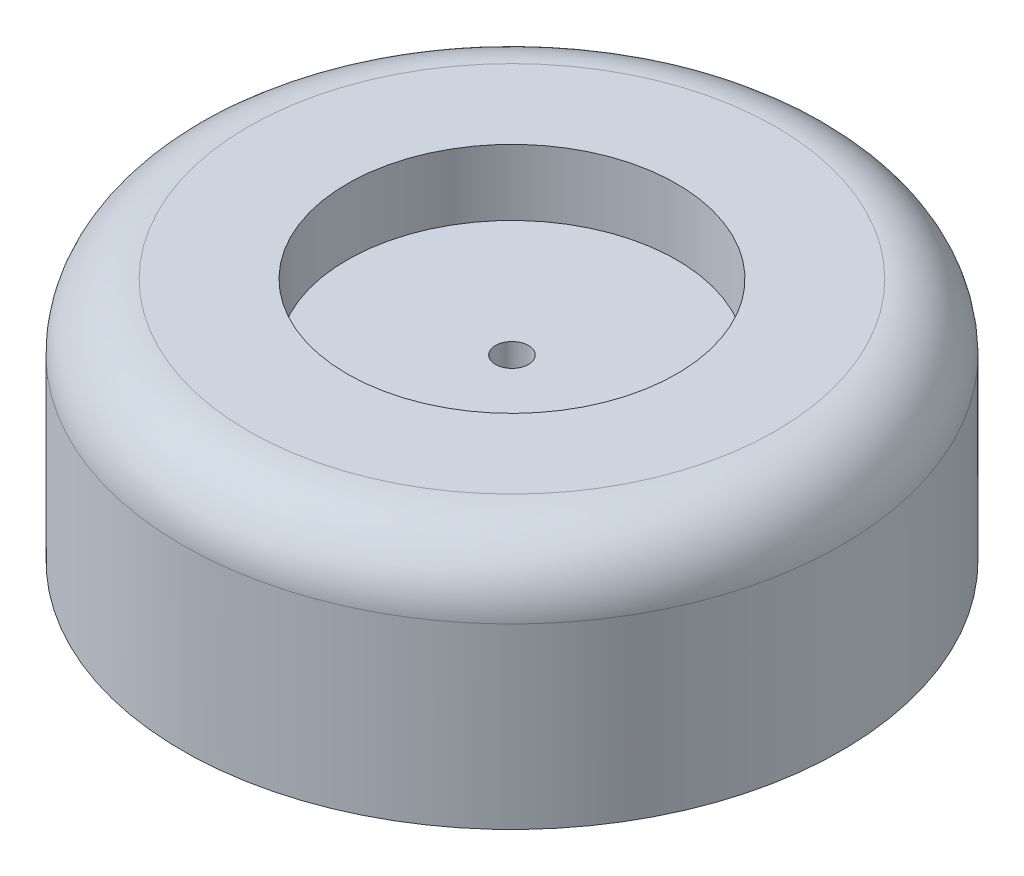
from build123d import *

# Parameters (mm, degrees)
SKETCH1_R               = 50
SKETCH1_R_2             = 47.5
BOSS_EXTRUDE1_DEPTH     = 10
SKETCH2_R               = 50
BOSS_EXTRUDE2_DEPTH     = 30
SKETCH4_R               = 2.5
SKETCH6_R               = 50
CUT_EXTRUDE2_DEPTH      = 3
CUT_EXTRUDE3_DEPTH      = 80.806014811
CUT_EXTRUDE3_DEPTH_BACK = 80.806014811
SKETCH7_R               = 2.5
FILLET1_R               = 10
SKETCH9_R               = 25
CUT_EXTRUDE5_DEPTH      = 10
SKETCH10_R              = 22
SKETCH10_R_2            = 15
CUT_EXTRUDE6_DEPTH      = 4


with BuildPart() as part:
    # Sketch1 → Boss-Extrude1 (new body)
    with BuildSketch(Plane(origin=(0, 0, 0), x_dir=(1, 0, 0), z_dir=(0, 1, 0))):
        Circle(SKETCH1_R)
        Circle(SKETCH1_R_2, mode=Mode.SUBTRACT)
    extrude(amount=BOSS_EXTRUDE1_DEPTH)

    # Sketch2 → Boss-Extrude2 (add)
    with BuildSketch(Plane(origin=(0, 10, 0), x_dir=(1, 0, 0), z_dir=(0, 1, 0))):
        Circle(SKETCH2_R)
    extrude(amount=BOSS_EXTRUDE2_DEPTH)

    # Cut-Sweep1: sweep along a path in Sketch3
    with BuildLine(Plane.XZ.offset(-10)) as cut_sweep1_path:
        CenterArc((0, 0), 42.5, 0, 360)
    # Sketch4 → Cut-Sweep1 (sweep, cut)
    with BuildSketch(Plane.XY):
        with Locations((42.5, 10)):
            Circle(SKETCH4_R)
    sweep(path=cut_sweep1_path.line, mode=Mode.SUBTRACT)

    # Sketch6 → Cut-Extrude2 (cut)
    with BuildSketch(Plane.XZ):
        Circle(SKETCH6_R)
    extrude(amount=-CUT_EXTRUDE2_DEPTH, mode=Mode.SUBTRACT)

    # Sketch7 → Cut-Extrude3 (cut, two sides: drawn at the far end of the back side and taken through both)
    with BuildSketch(Plane(origin=(0, 40, 0), x_dir=(1, 0, 0), z_dir=(0, 1, 0)).offset(-CUT_EXTRUDE3_DEPTH_BACK)):
        Circle(SKETCH7_R)
    extrude(amount=CUT_EXTRUDE3_DEPTH + CUT_EXTRUDE3_DEPTH_BACK, mode=Mode.SUBTRACT)

    # Fillet1
    fillet1_edges = [part.edges().sort_by_distance(p)[0] for p in [
        (-50, 40, 0),
    ]]
    fillet(fillet1_edges, radius=FILLET1_R)

    # Sketch9 → Cut-Extrude5 (cut)
    with BuildSketch(Plane(origin=(0, 40, 0), x_dir=(1, 0, 0), z_dir=(0, 1, 0))):
        Circle(SKETCH9_R)
    extrude(amount=-CUT_EXTRUDE5_DEPTH, mode=Mode.SUBTRACT)

    # Sketch10 → Cut-Extrude6 (cut)
    with BuildSketch(Plane.XZ.offset(-10)):
        Circle(SKETCH10_R)
        Circle(SKETCH10_R_2, mode=Mode.SUBTRACT)
    extrude(amount=-CUT_EXTRUDE6_DEPTH, mode=Mode.SUBTRACT)


solid = part.part
